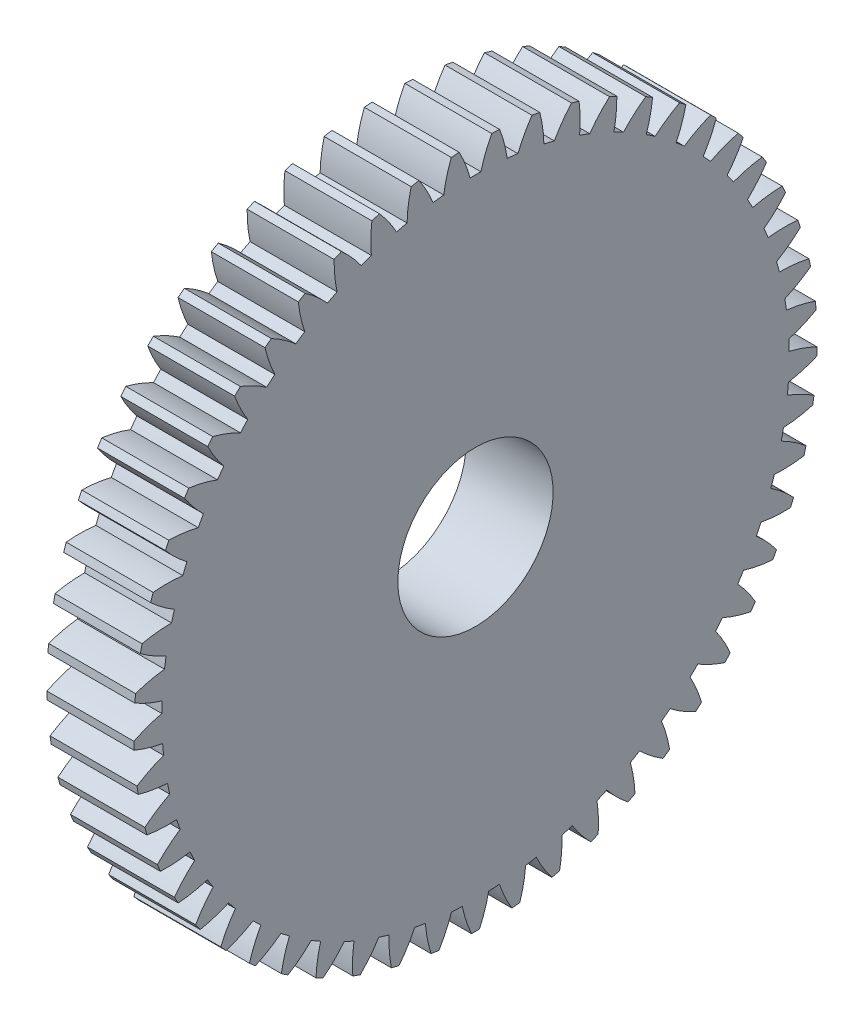
from build123d import *

# Parameters (mm, degrees)
BASPROSKE_W     = 2.8
BASPROSKE_H     = 11
TOOTHCUT_DEPTH  = 16.806327847
TEETHCUTS_COUNT = 53
TEETHCUTS_ANGLE = 353.20754717
BORSKE_R        = 2.5
BORE_DEPTH      = 50.0000508


with BuildPart() as part:
    # BasProSke → Base-Revolve (revolve)
    with BuildSketch(Plane(origin=(0, 0, 0), x_dir=(1, 0, 0), z_dir=(0, 1, 0))):
        with Locations((1.4, 5.5)):
            Rectangle(BASPROSKE_W, BASPROSKE_H)
    revolve(axis=Axis((-10, 0, 0), (1, 0, 0)))

    # TooCutSke → ToothCut (cut, through all)
    with BuildSketch(Plane(origin=(0, 0, 0), x_dir=(0, 0, -1), z_dir=(1, 0, 0))):
        with BuildLine():
            ThreePointArc((0.173557579, 10.097508543), (0, 10.099), (-0.173557579, 10.097508543))
            ThreePointArc((-0.173557579, 10.097508543), (-0.328696662, 10.565495442), (-0.537112824, 11.012309248))
            ThreePointArc((-0.537112824, 11.012309248), (0, 11.0254), (0.537112824, 11.012309248))
            ThreePointArc((0.537112824, 11.012309248), (0.328696662, 10.565495442), (0.173557579, 10.097508543))
        make_face()
    toothcut = extrude(amount=TOOTHCUT_DEPTH, mode=Mode.SUBTRACT)

    # TeethCuts: ToothCut ×53 about axis
    teethcuts_axis = Axis((-10, 0, 0), (1, 0, 0))
    for i in range(1, TEETHCUTS_COUNT):
        add(toothcut.rotate(teethcuts_axis, i * TEETHCUTS_ANGLE / (TEETHCUTS_COUNT - 1)), mode=Mode.SUBTRACT)

    # BorSke → Bore (cut, symmetric)
    with BuildSketch(Plane(origin=(0, 0, 0), x_dir=(0, 0, -1), z_dir=(1, 0, 0))):
        Circle(BORSKE_R)
    extrude(amount=BORE_DEPTH, both=True, mode=Mode.SUBTRACT)


solid = part.part
